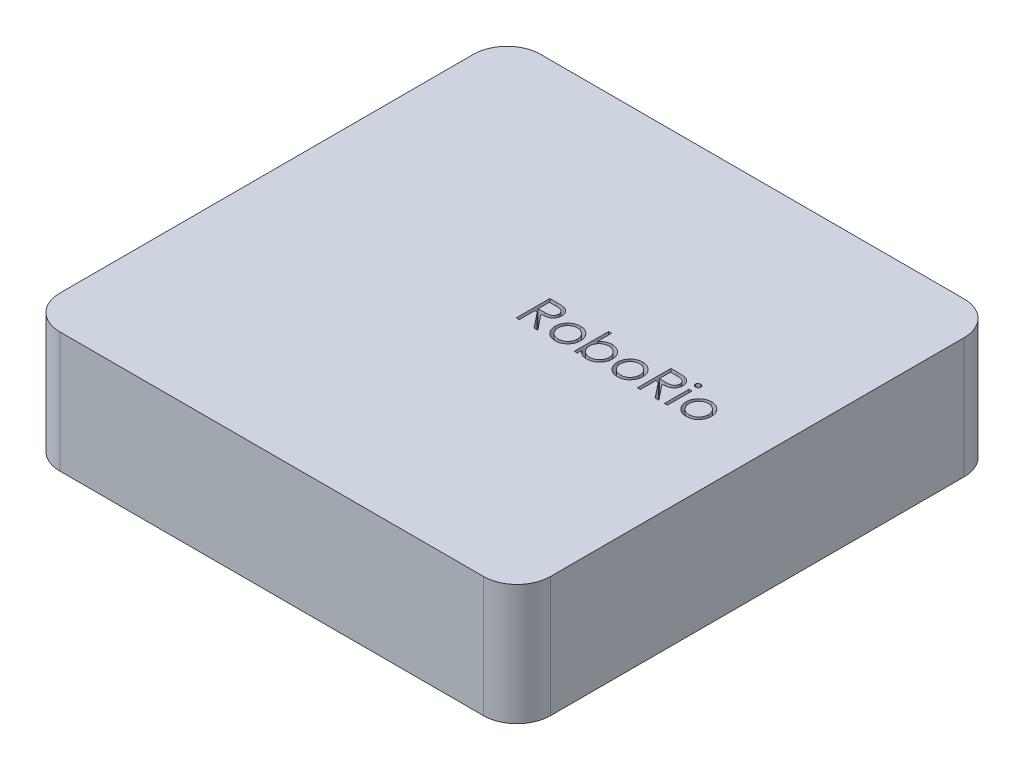
from build123d import *

# Parameters (mm, degrees)
SKETCH1_W           = 146.5
SKETCH1_H           = 143.5
BOSS_EXTRUDE1_DEPTH = 36
FILLET1_R           = 10
SKETCH2_W           = 0.897435897
SKETCH2_H           = 7.307692308
CUT_EXTRUDE1_DEPTH  = 10


with BuildPart() as part:
    # Sketch1 → Boss-Extrude1 (new body)
    with BuildSketch(Plane(origin=(0, 0, 0), x_dir=(1, 0, 0), z_dir=(0, 1, 0))):
        Rectangle(SKETCH1_W, SKETCH1_H)
    extrude(amount=BOSS_EXTRUDE1_DEPTH)

    # Fillet1
    fillet1_edges = [part.edges().sort_by_distance(p)[0] for p in [
        (73.25, 18, 71.75),
        (73.25, 18, -71.75),
        (-73.25, 18, -71.75),
        (-73.25, 18, 71.75),
    ]]
    fillet(fillet1_edges, radius=FILLET1_R)

    # Sketch2 → Cut-Extrude1 (cut)
    # profile 1 of 8: a face of its own
    with BuildSketch(Plane(origin=(0, 36, 0), x_dir=(1, 0, 0), z_dir=(0, 1, 0))):
        with BuildLine():
            Line((1.282051282, 10), (3.283253205, 10))
            add(Edge.make_bspline(
                [(3.283253205, 10), (3.416799287, 9.999555469), (3.673222556, 9.998701919), (4.040574757, 9.993942596), (4.374366463, 9.98030158), (4.674423147, 9.96856277), (4.940739304, 9.947157224), (5.174131563, 9.926698232), (5.373524985, 9.899916344), (5.494227417, 9.875043707), (5.548878205, 9.863782051)],
                knots=[0, 0, 0, 0, 1.410062039, 2.707475311, 3.878576406, 4.937260626, 5.877586885, 6.699081471, 7.410979367, 8, 8, 8, 8], degree=3))
            add(Edge.make_bspline(
                [(5.548878205, 9.863782051), (5.622039988, 9.845705579), (5.766802815, 9.809938254), (5.975231576, 9.734339395), (6.17384393, 9.646854753), (6.361814856, 9.544101266), (6.538202831, 9.425316181), (6.704826576, 9.292550117), (6.862442186, 9.146529529), (7.004675415, 8.983572839), (7.138786991, 8.812611383), (7.251897353, 8.627743506), (7.349401581, 8.434424856), (7.427031629, 8.230689377), (7.489540125, 8.018512886), (7.533615094, 7.795973467), (7.560047059, 7.564084967), (7.562738075, 7.405919513), (7.564102564, 7.325721154)],
                knots=[0, 0, 0, 0, 1.027469482, 2.033020251, 3.019912614, 3.986113645, 4.951240523, 5.91722682, 6.890402269, 7.87763091, 8.8651537, 9.85103654, 10.82876324, 11.815024772, 12.821070561, 13.842952187, 14.906261191, 16, 16, 16, 16], degree=3))
            add(Edge.make_bspline(
                [(7.564102564, 7.325721154), (7.559905427, 7.192477998), (7.551715724, 6.93248609), (7.475358285, 6.555169286), (7.350282515, 6.203199815), (7.17793026, 5.87702085), (6.958446044, 5.582990434), (6.694660927, 5.324731991), (6.386427751, 5.108617955), (6.099486848, 4.958752798), (5.846017706, 4.862773059), (5.637351098, 4.795240606), (5.409731163, 4.743063562), (5.165338778, 4.696320328), (4.903156905, 4.661029773), (4.623813935, 4.63518236), (4.327110645, 4.619027935), (4.123284733, 4.616622207), (4.018429487, 4.615384615)],
                knots=[0, 0, 0, 0, 1.260483769, 2.459530307, 3.627416485, 4.787058657, 5.939039949, 7.08810263, 8.267026773, 9.491475466, 10.141966685, 10.831826277, 11.566392101, 12.351337768, 13.187381173, 14.07005841, 15.007169909, 16, 16, 16, 16], degree=3))
            Line((4.018429487, 4.615384615), (7.692307692, 0))
            Line((7.692307692, 0), (6.582532051, 0))
            Line((6.582532051, 0), (2.908653846, 4.615384615))
            Line((2.908653846, 4.615384615), (2.179487179, 4.615384615))
            Line((2.179487179, 4.615384615), (2.179487179, 0))
            Line((2.179487179, 0), (1.282051282, 0))
            Line((1.282051282, 0), (1.282051282, 10))
        make_face()
        with BuildLine():
            Line((2.179487179, 8.974358974), (2.179487179, 5.641025641))
            Line((2.179487179, 5.641025641), (4.010416667, 5.627003205))
            add(Edge.make_bspline(
                [(4.010416667, 5.627003205), (4.095902492, 5.626965386), (4.26159837, 5.626892082), (4.501314555, 5.638302871), (4.724514874, 5.651283781), (4.930345594, 5.671139054), (5.118898667, 5.69672783), (5.290079847, 5.728736356), (5.444168567, 5.766027964), (5.623878677, 5.823746895), (5.824554481, 5.915192661), (6.042644366, 6.048236943), (6.228365331, 6.215577284), (6.385273509, 6.406930015), (6.511357599, 6.617319298), (6.600249183, 6.84422321), (6.656656161, 7.08191349), (6.663309148, 7.245279512), (6.666666667, 7.327724359)],
                knots=[0, 0, 0, 0, 1.146690395, 2.22261258, 3.21895312, 4.145990853, 4.996080663, 5.770904154, 6.481378293, 7.121626537, 8.300444488, 9.431385265, 10.535395872, 11.636531494, 12.74115979, 13.810798291, 14.895190096, 16, 16, 16, 16], degree=3))
            add(Edge.make_bspline(
                [(6.666666667, 7.327724359), (6.663232035, 7.408143141), (6.656425848, 7.567503823), (6.600857938, 7.800806424), (6.506888277, 8.02099771), (6.380253312, 8.227181953), (6.225970012, 8.414341198), (6.045061976, 8.574475921), (5.842475704, 8.706617249), (5.653129423, 8.791058336), (5.483888816, 8.842829345), (5.33694693, 8.879261242), (5.170914136, 8.908531153), (4.984984254, 8.931982755), (4.779951024, 8.952139739), (4.554777735, 8.96571625), (4.310958363, 8.973755861), (4.141967131, 8.974153258), (4.054487179, 8.974358974)],
                knots=[0, 0, 0, 0, 1.101028733, 2.181837193, 3.264309656, 4.369019818, 5.486613113, 6.575447106, 7.666700264, 8.788928104, 9.402425223, 10.0903467, 10.862060571, 11.710948788, 12.657782767, 13.684531032, 14.801375019, 16, 16, 16, 16], degree=3))
            Line((4.054487179, 8.974358974), (2.179487179, 8.974358974))
        make_face(mode=Mode.SUBTRACT)
    # profile 2 of 8: a face of its own
    with BuildSketch(Plane(origin=(0, 36, 0), x_dir=(1, 0, 0), z_dir=(0, 1, 0))):
        with BuildLine():
            add(Edge.make_bspline(
                [(13.016826923, 7.435897436), (13.153944845, 7.432977747), (13.422799581, 7.42725295), (13.816536398, 7.366067334), (14.192379644, 7.272503436), (14.551768764, 7.143156116), (14.890101037, 6.969779114), (15.212304592, 6.762895425), (15.517496045, 6.517802301), (15.700418986, 6.32820782), (15.793269231, 6.231971154)],
                knots=[0, 0, 0, 0, 1.054011418, 2.066658804, 3.057071809, 4.030435133, 4.997543892, 5.974964718, 6.972108034, 8, 8, 8, 8], degree=3))
            add(Edge.make_bspline(
                [(15.793269231, 6.231971154), (15.873217671, 6.139931194), (16.031567329, 5.957632502), (16.23461224, 5.662045037), (16.409530983, 5.355930464), (16.549710871, 5.035223816), (16.660239511, 4.702724756), (16.738712928, 4.357290438), (16.785389885, 3.999683732), (16.791684077, 3.756815623), (16.794871795, 3.633814103)],
                knots=[0, 0, 0, 0, 1.025258237, 2.030674902, 3.01204498, 3.988269485, 4.97094183, 5.956517959, 6.965070386, 8, 8, 8, 8], degree=3))
            add(Edge.make_bspline(
                [(16.794871795, 3.633814103), (16.792067974, 3.510099652), (16.786527493, 3.265634128), (16.734117161, 2.905578797), (16.652599772, 2.556450733), (16.535937378, 2.219711608), (16.38634278, 1.894332101), (16.203797958, 1.581733388), (15.987021909, 1.281298722), (15.741296204, 0.995579184), (15.469719415, 0.732247142), (15.175101848, 0.5027378), (14.863233181, 0.306104874), (14.529966457, 0.147715115), (14.178345066, 0.022830257), (13.807610586, -0.064884076), (13.418338956, -0.117917458), (13.152546895, -0.124727668), (13.016826923, -0.128205128)],
                knots=[0, 0, 0, 0, 0.998656419, 1.973391657, 2.932242238, 3.890759089, 4.846373663, 5.82037756, 6.809684879, 7.83454468, 8.860553229, 9.859544525, 10.845671541, 11.83227036, 12.833544569, 13.85385346, 14.904124723, 16, 16, 16, 16], degree=3))
            add(Edge.make_bspline(
                [(13.016826923, -0.128205128), (12.88044201, -0.124715996), (12.613325268, -0.117882355), (12.222679605, -0.065090118), (11.851280694, 0.022789832), (11.499198984, 0.148125525), (11.164499421, 0.306109936), (10.850823716, 0.502143335), (10.555966814, 0.732315207), (10.284332573, 0.995560741), (10.038622272, 1.281303474), (9.821842248, 1.581732155), (9.639298459, 1.894332422), (9.489703591, 2.219711522), (9.373041269, 2.556450756), (9.291523861, 2.905578791), (9.239113534, 3.26563413), (9.233573052, 3.510099653), (9.230769231, 3.633814103)],
                knots=[0, 0, 0, 0, 1.099876186, 2.154163076, 3.173186993, 4.173200201, 5.163417411, 6.152872554, 7.150605724, 8.17532212, 9.198891216, 10.186952605, 11.159729845, 12.11414092, 13.071450619, 14.029093627, 15.002601286, 16, 16, 16, 16], degree=3))
            add(Edge.make_bspline(
                [(9.230769231, 3.633814103), (9.233978689, 3.756147091), (9.240332864, 3.998345383), (9.28696289, 4.355279842), (9.365130195, 4.700129525), (9.475791327, 5.031345171), (9.617263301, 5.350646417), (9.789724124, 5.657517363), (9.994840217, 5.951768221), (10.152560079, 6.133831307), (10.232371795, 6.225961538)],
                knots=[0, 0, 0, 0, 1.031353054, 2.041901799, 3.029428768, 4.008703097, 4.981709435, 5.96992636, 6.972712378, 8, 8, 8, 8], degree=3))
            add(Edge.make_bspline(
                [(10.232371795, 6.225961538), (10.325082055, 6.323032793), (10.507413095, 6.513940497), (10.814123745, 6.758319137), (11.135534663, 6.96950792), (11.47760588, 7.139439964), (11.83669976, 7.2732643), (12.214469024, 7.366308629), (12.609541926, 7.4270325), (12.879712272, 7.432913008), (13.016826923, 7.435897436)],
                knots=[0, 0, 0, 0, 1.027980169, 2.021703884, 2.998553061, 3.971491411, 4.943284454, 5.930300938, 6.949603206, 8, 8, 8, 8], degree=3))
        make_face()
        with BuildLine():
            add(Edge.make_bspline(
                [(13.012820513, 6.538461538), (12.915855909, 6.535705562), (12.724429827, 6.530264755), (12.442659585, 6.48888217), (12.171402002, 6.423317873), (11.910142448, 6.330163426), (11.659761955, 6.209880858), (11.420020805, 6.062142686), (11.190213834, 5.888905667), (10.97483651, 5.690440891), (10.777172761, 5.473643764), (10.604378543, 5.242648453), (10.457449667, 5.001201749), (10.335049213, 4.749052575), (10.243885818, 4.483645678), (10.177677183, 4.207986731), (10.136333639, 3.921514113), (10.130943986, 3.726768346), (10.128205128, 3.627804487)],
                knots=[0, 0, 0, 0, 1.021534396, 2.016698045, 2.994645724, 3.958388632, 4.93408049, 5.916473867, 6.921342795, 7.962252576, 8.998418191, 10.008913653, 10.997312074, 11.973003931, 12.956656626, 13.948281152, 14.957379055, 16, 16, 16, 16], degree=3))
            add(Edge.make_bspline(
                [(10.128205128, 3.627804487), (10.132796053, 3.499941552), (10.14190818, 3.246157537), (10.216008855, 2.872411472), (10.339969655, 2.51360618), (10.507361883, 2.171845077), (10.717093936, 1.855638569), (10.964199841, 1.573720042), (11.246027556, 1.330332009), (11.559217557, 1.128386736), (11.897372751, 0.967930291), (12.255247954, 0.854218932), (12.62850708, 0.780299811), (12.883594883, 0.772952741), (13.012820513, 0.769230769)],
                knots=[0, 0, 0, 0, 1.016792936, 2.018143844, 3.017858371, 4.030088057, 5.03801393, 6.028138512, 7.003788237, 7.991172063, 8.984598303, 9.972568034, 10.972917682, 12, 12, 12, 12], degree=3))
            add(Edge.make_bspline(
                [(13.012820513, 0.769230769), (13.14203871, 0.772974427), (13.397111841, 0.780364304), (13.769852346, 0.853846646), (14.126749409, 0.968428534), (14.464553373, 1.128206276), (14.777600812, 1.33109889), (15.061455444, 1.572345681), (15.306451476, 1.856385257), (15.515976061, 2.17226391), (15.686109612, 2.513076345), (15.809490188, 2.872477694), (15.883769005, 3.246140671), (15.892857087, 3.499935902), (15.897435897, 3.627804487)],
                knots=[0, 0, 0, 0, 1.02726834, 2.027799167, 3.010890988, 4.004497153, 4.992059811, 5.971914811, 6.958719428, 7.966827853, 8.981595046, 9.981490638, 10.983022906, 12, 12, 12, 12], degree=3))
            add(Edge.make_bspline(
                [(15.897435897, 3.627804487), (15.894697983, 3.726768938), (15.889310186, 3.921515868), (15.847953145, 4.207980021), (15.78179446, 4.483670297), (15.690446982, 4.748961735), (15.568578371, 5.001854605), (15.418816105, 5.241939539), (15.246727461, 5.474443957), (15.046678544, 5.689740073), (14.831526036, 5.888983035), (14.601625927, 6.062209862), (14.362240274, 6.209231563), (14.11258718, 6.33119225), (13.85129413, 6.422470366), (13.580416618, 6.489260741), (13.29984859, 6.530089875), (13.109108466, 6.535653136), (13.012820513, 6.538461538)],
                knots=[0, 0, 0, 0, 1.042956736, 2.052379634, 3.044323526, 4.02829302, 5.004299113, 5.996692471, 7.007513377, 8.048758398, 9.090003419, 10.095195979, 11.07790575, 12.047570684, 13.018257071, 13.989683339, 14.985167495, 16, 16, 16, 16], degree=3))
        make_face(mode=Mode.SUBTRACT)
    # profile 3 of 8: a face of its own
    with BuildSketch(Plane(origin=(0, 36, 0), x_dir=(1, 0, 0), z_dir=(0, 1, 0))):
        with BuildLine():
            Line((18.58974359, 0), (18.58974359, 10.256410256))
            Line((18.58974359, 10.256410256), (19.487179487, 10.256410256))
            Line((19.487179487, 10.256410256), (19.487179487, 5.981570513))
            add(Edge.make_bspline(
                [(19.487179487, 5.981570513), (19.588303541, 6.098021747), (19.78560074, 6.325222905), (20.116390601, 6.621930476), (20.463263657, 6.873508982), (20.828858673, 7.080897892), (21.213695625, 7.238822484), (21.615787364, 7.354315026), (22.036161766, 7.423991892), (22.322787977, 7.431894958), (22.467948718, 7.435897436)],
                knots=[0, 0, 0, 0, 1.077089805, 2.101446609, 3.097517232, 4.067117542, 5.031729543, 5.997785507, 6.985986182, 8, 8, 8, 8], degree=3))
            add(Edge.make_bspline(
                [(22.467948718, 7.435897436), (22.596994826, 7.432353927), (22.852140974, 7.425347805), (23.227232823, 7.37210639), (23.588127895, 7.285769813), (23.934629746, 7.166077872), (24.265121553, 7.007269366), (24.582433145, 6.817151344), (24.884938815, 6.590756117), (25.167952773, 6.331903801), (25.428792448, 6.050884879), (25.657113906, 5.750369692), (25.849970181, 5.434726577), (26.00948816, 5.105012113), (26.132834025, 4.759879681), (26.217811931, 4.399667685), (26.271793258, 4.024730489), (26.278593961, 3.76955105), (26.282051282, 3.639823718)],
                knots=[0, 0, 0, 0, 1.034377878, 2.045141349, 3.03070803, 4.00595497, 4.978199603, 5.965204761, 6.967410914, 8.002051993, 9.036360596, 10.037508045, 11.022711142, 11.997267194, 12.969246472, 13.954813154, 14.960274251, 16, 16, 16, 16], degree=3))
            add(Edge.make_bspline(
                [(26.282051282, 3.639823718), (26.278518595, 3.512109382), (26.271552692, 3.260276824), (26.218348955, 2.889686663), (26.130502484, 2.533004665), (26.004899103, 2.191152502), (25.846999278, 1.862524178), (25.649538491, 1.55086588), (25.421507064, 1.250754521), (25.157703782, 0.97182986), (24.872236488, 0.714020146), (24.566767223, 0.490003388), (24.248990304, 0.296525902), (23.91395284, 0.143224623), (23.566615579, 0.019221991), (23.203257331, -0.066828554), (22.825933822, -0.117037283), (22.569594141, -0.124453189), (22.439903846, -0.128205128)],
                knots=[0, 0, 0, 0, 1.024244038, 2.01964794, 2.996620209, 3.965911562, 4.936179293, 5.91563013, 6.920572822, 7.955171681, 8.990768464, 10.002129126, 10.989675881, 11.969873457, 12.952483066, 13.943799762, 14.959703725, 16, 16, 16, 16], degree=3))
            add(Edge.make_bspline(
                [(22.439903846, -0.128205128), (22.291432097, -0.124089105), (22.000304884, -0.1160183), (21.574440127, -0.049106931), (21.171349985, 0.064783384), (20.786442704, 0.217816972), (20.425220639, 0.425041698), (20.085390403, 0.682060984), (19.769095052, 0.993109945), (19.582761294, 1.230428488), (19.487179487, 1.352163462)],
                knots=[0, 0, 0, 0, 1.035807596, 2.031038093, 2.998900396, 3.954262848, 4.914341711, 5.895762244, 6.92060972, 8, 8, 8, 8], degree=3))
            Line((19.487179487, 1.352163462), (19.487179487, 0))
            Line((19.487179487, 0), (18.58974359, 0))
        make_face()
        with BuildLine():
            add(Edge.make_bspline(
                [(22.431891026, 0.769230769), (22.56307489, 0.77389828), (22.822010972, 0.783111205), (23.202136088, 0.855035842), (23.565890972, 0.974704739), (23.911442636, 1.138372477), (24.233383527, 1.344149719), (24.520962482, 1.593138778), (24.776618794, 1.87742882), (24.989909583, 2.198096515), (25.167984567, 2.539384998), (25.290308214, 2.898397288), (25.37236456, 3.265525257), (25.380513984, 3.514513955), (25.384615385, 3.639823718)],
                knots=[0, 0, 0, 0, 1.031910345, 2.036826888, 3.032245421, 4.038315463, 5.03827337, 6.029480047, 7.023177075, 8.037597977, 9.052889626, 10.043399556, 11.015292101, 12, 12, 12, 12], degree=3))
            add(Edge.make_bspline(
                [(25.384615385, 3.639823718), (25.379221831, 3.765010981), (25.368456255, 4.014885726), (25.293099734, 4.385313346), (25.161506048, 4.744135131), (24.986883125, 5.090357956), (24.770117452, 5.413237385), (24.515814699, 5.703209177), (24.224723825, 5.953380561), (23.902371198, 6.161923621), (23.558999224, 6.332093773), (23.197597414, 6.448793845), (22.825717063, 6.525188666), (22.573158513, 6.534014747), (22.445913462, 6.538461538)],
                knots=[0, 0, 0, 0, 0.984795267, 1.965658976, 2.959410029, 3.983795688, 5.009594896, 6.01088574, 7.009236619, 8.019050059, 9.024672985, 10.014834719, 10.999826153, 12, 12, 12, 12], degree=3))
            add(Edge.make_bspline(
                [(22.445913462, 6.538461538), (22.316006297, 6.53401726), (22.058166936, 6.525196269), (21.677686301, 6.448659629), (21.306076919, 6.331380739), (20.950969685, 6.163005456), (20.619958098, 5.956972711), (20.323922063, 5.714857856), (20.068689041, 5.438343832), (19.858563982, 5.128327256), (19.691693128, 4.793512869), (19.572310991, 4.436335145), (19.500883429, 4.058674252), (19.49180305, 3.799722236), (19.487179487, 3.66786859)],
                knots=[0, 0, 0, 0, 1.016820015, 2.018181405, 3.029022337, 4.06341356, 5.088169224, 6.076823655, 7.05054209, 8.02560866, 9.001194327, 9.972267242, 10.967515442, 12, 12, 12, 12], degree=3))
            add(Edge.make_bspline(
                [(19.487179487, 3.66786859), (19.489921403, 3.566903394), (19.49531836, 3.368171939), (19.536547985, 3.076378537), (19.60213559, 2.79714113), (19.694545573, 2.530155429), (19.815977672, 2.27693703), (19.962292717, 2.035519658), (20.136440278, 1.80808172), (20.333316248, 1.595180805), (20.550351621, 1.401439621), (20.783274817, 1.233501835), (21.027326048, 1.088889863), (21.285297394, 0.973618885), (21.554186795, 0.879543111), (21.836753484, 0.817446695), (22.13010041, 0.77466087), (22.330234974, 0.77105986), (22.431891026, 0.769230769)],
                knots=[0, 0, 0, 0, 1.050331198, 2.067384183, 3.060053655, 4.031335885, 5.001026174, 5.976994447, 6.963687968, 7.976578778, 8.990422448, 9.985569286, 10.960374351, 11.936812464, 12.921228065, 13.919088064, 14.943024695, 16, 16, 16, 16], degree=3))
        make_face(mode=Mode.SUBTRACT)
    # profile 4 of 8: a face of its own
    with BuildSketch(Plane(origin=(0, 36, 0), x_dir=(1, 0, 0), z_dir=(0, 1, 0))):
        with BuildLine():
            add(Edge.make_bspline(
                [(31.606570513, 7.435897436), (31.743688435, 7.432977747), (32.012543171, 7.42725295), (32.406279988, 7.366067334), (32.782123233, 7.272503436), (33.141512354, 7.143156116), (33.479844627, 6.969779114), (33.802048181, 6.762895425), (34.107239635, 6.517802301), (34.290162576, 6.32820782), (34.383012821, 6.231971154)],
                knots=[0, 0, 0, 0, 1.054011418, 2.066658804, 3.057071809, 4.030435133, 4.997543892, 5.974964718, 6.972108034, 8, 8, 8, 8], degree=3))
            add(Edge.make_bspline(
                [(34.383012821, 6.231971154), (34.462961261, 6.139931194), (34.621310919, 5.957632502), (34.824355829, 5.662045037), (34.999274573, 5.355930464), (35.139454461, 5.035223816), (35.2499831, 4.702724756), (35.328456518, 4.357290438), (35.375133475, 3.999683732), (35.381427666, 3.756815623), (35.384615385, 3.633814103)],
                knots=[0, 0, 0, 0, 1.025258237, 2.030674902, 3.01204498, 3.988269485, 4.97094183, 5.956517959, 6.965070386, 8, 8, 8, 8], degree=3))
            add(Edge.make_bspline(
                [(35.384615385, 3.633814103), (35.381811564, 3.510099652), (35.376271083, 3.265634128), (35.32386075, 2.905578797), (35.242343362, 2.556450733), (35.125680967, 2.219711608), (34.976086369, 1.894332101), (34.793541548, 1.581733388), (34.576765499, 1.281298722), (34.331039794, 0.995579184), (34.059463005, 0.732247142), (33.764845438, 0.5027378), (33.45297677, 0.306104874), (33.119710047, 0.147715115), (32.768088656, 0.022830257), (32.397354175, -0.064884076), (32.008082546, -0.117917458), (31.742290485, -0.124727668), (31.606570513, -0.128205128)],
                knots=[0, 0, 0, 0, 0.998656419, 1.973391657, 2.932242238, 3.890759089, 4.846373663, 5.82037756, 6.809684879, 7.83454468, 8.860553229, 9.859544525, 10.845671541, 11.83227036, 12.833544569, 13.85385346, 14.904124723, 16, 16, 16, 16], degree=3))
            add(Edge.make_bspline(
                [(31.606570513, -0.128205128), (31.4701856, -0.124715996), (31.203068858, -0.117882355), (30.812423195, -0.065090118), (30.441024284, 0.022789832), (30.088942574, 0.148125525), (29.754243011, 0.306109936), (29.440567306, 0.502143335), (29.145710404, 0.732315207), (28.874076163, 0.995560741), (28.628365862, 1.281303474), (28.411585838, 1.581732155), (28.229042049, 1.894332422), (28.079447181, 2.219711522), (27.962784858, 2.556450756), (27.881267451, 2.905578791), (27.828857123, 3.26563413), (27.823316642, 3.510099653), (27.820512821, 3.633814103)],
                knots=[0, 0, 0, 0, 1.099876186, 2.154163076, 3.173186993, 4.173200201, 5.163417411, 6.152872554, 7.150605724, 8.17532212, 9.198891216, 10.186952605, 11.159729845, 12.11414092, 13.071450619, 14.029093627, 15.002601286, 16, 16, 16, 16], degree=3))
            add(Edge.make_bspline(
                [(27.820512821, 3.633814103), (27.823722279, 3.756147091), (27.830076454, 3.998345383), (27.87670648, 4.355279842), (27.954873784, 4.700129525), (28.065534917, 5.031345171), (28.207006891, 5.350646417), (28.379467714, 5.657517363), (28.584583807, 5.951768221), (28.742303668, 6.133831307), (28.822115385, 6.225961538)],
                knots=[0, 0, 0, 0, 1.031353054, 2.041901799, 3.029428768, 4.008703097, 4.981709435, 5.96992636, 6.972712378, 8, 8, 8, 8], degree=3))
            add(Edge.make_bspline(
                [(28.822115385, 6.225961538), (28.914825645, 6.323032793), (29.097156684, 6.513940497), (29.403867335, 6.758319137), (29.725278252, 6.96950792), (30.06734947, 7.139439964), (30.42644335, 7.2732643), (30.804212614, 7.366308629), (31.199285515, 7.4270325), (31.469455861, 7.432913008), (31.606570513, 7.435897436)],
                knots=[0, 0, 0, 0, 1.027980169, 2.021703884, 2.998553061, 3.971491411, 4.943284454, 5.930300938, 6.949603206, 8, 8, 8, 8], degree=3))
        make_face()
        with BuildLine():
            add(Edge.make_bspline(
                [(31.602564103, 6.538461538), (31.505599499, 6.535705562), (31.314173417, 6.530264755), (31.032403175, 6.48888217), (30.761145592, 6.423317873), (30.499886038, 6.330163426), (30.249505545, 6.209880858), (30.009764395, 6.062142686), (29.779957424, 5.888905667), (29.5645801, 5.690440891), (29.366916351, 5.473643764), (29.194122132, 5.242648453), (29.047193257, 5.001201749), (28.924792803, 4.749052575), (28.833629408, 4.483645678), (28.767420773, 4.207986731), (28.726077228, 3.921514113), (28.720687575, 3.726768346), (28.717948718, 3.627804487)],
                knots=[0, 0, 0, 0, 1.021534396, 2.016698045, 2.994645724, 3.958388632, 4.93408049, 5.916473867, 6.921342795, 7.962252576, 8.998418191, 10.008913653, 10.997312074, 11.973003931, 12.956656626, 13.948281152, 14.957379055, 16, 16, 16, 16], degree=3))
            add(Edge.make_bspline(
                [(28.717948718, 3.627804487), (28.722539643, 3.499941552), (28.73165177, 3.246157537), (28.805752445, 2.872411472), (28.929713245, 2.51360618), (29.097105473, 2.171845077), (29.306837526, 1.855638569), (29.553943431, 1.573720042), (29.835771146, 1.330332009), (30.148961147, 1.128386736), (30.487116341, 0.967930291), (30.844991544, 0.854218932), (31.21825067, 0.780299811), (31.473338473, 0.772952741), (31.602564103, 0.769230769)],
                knots=[0, 0, 0, 0, 1.016792936, 2.018143844, 3.017858371, 4.030088057, 5.03801393, 6.028138512, 7.003788237, 7.991172063, 8.984598303, 9.972568034, 10.972917682, 12, 12, 12, 12], degree=3))
            add(Edge.make_bspline(
                [(31.602564103, 0.769230769), (31.7317823, 0.772974427), (31.986855431, 0.780364304), (32.359595936, 0.853846646), (32.716492999, 0.968428534), (33.054296963, 1.128206276), (33.367344401, 1.33109889), (33.651199034, 1.572345681), (33.896195065, 1.856385257), (34.105719651, 2.17226391), (34.275853202, 2.513076345), (34.399233778, 2.872477694), (34.473512595, 3.246140671), (34.482600677, 3.499935902), (34.487179487, 3.627804487)],
                knots=[0, 0, 0, 0, 1.02726834, 2.027799167, 3.010890988, 4.004497153, 4.992059811, 5.971914811, 6.958719428, 7.966827853, 8.981595046, 9.981490638, 10.983022906, 12, 12, 12, 12], degree=3))
            add(Edge.make_bspline(
                [(34.487179487, 3.627804487), (34.484441573, 3.726768938), (34.479053775, 3.921515868), (34.437696734, 4.207980021), (34.37153805, 4.483670297), (34.280190572, 4.748961735), (34.158321961, 5.001854605), (34.008559695, 5.241939539), (33.836471051, 5.474443957), (33.636422134, 5.689740073), (33.421269626, 5.888983035), (33.191369517, 6.062209862), (32.951983863, 6.209231563), (32.70233077, 6.33119225), (32.44103772, 6.422470366), (32.170160208, 6.489260741), (31.889592179, 6.530089875), (31.698852056, 6.535653136), (31.602564103, 6.538461538)],
                knots=[0, 0, 0, 0, 1.042956736, 2.052379634, 3.044323526, 4.02829302, 5.004299113, 5.996692471, 7.007513377, 8.048758398, 9.090003419, 10.095195979, 11.07790575, 12.047570684, 13.018257071, 13.989683339, 14.985167495, 16, 16, 16, 16], degree=3))
        make_face(mode=Mode.SUBTRACT)
    # profile 5 of 8: a face of its own
    with BuildSketch(Plane(origin=(0, 36, 0), x_dir=(1, 0, 0), z_dir=(0, 1, 0))):
        with BuildLine():
            Line((37.435897436, 10), (39.437099359, 10))
            add(Edge.make_bspline(
                [(39.437099359, 10), (39.57064544, 9.999555469), (39.82706871, 9.998701919), (40.194420911, 9.993942596), (40.528212617, 9.98030158), (40.828269301, 9.96856277), (41.094585458, 9.947157224), (41.327977717, 9.926698232), (41.527371138, 9.899916344), (41.648073571, 9.875043707), (41.702724359, 9.863782051)],
                knots=[0, 0, 0, 0, 1.410062039, 2.707475311, 3.878576406, 4.937260626, 5.877586885, 6.699081471, 7.410979367, 8, 8, 8, 8], degree=3))
            add(Edge.make_bspline(
                [(41.702724359, 9.863782051), (41.775886142, 9.845705579), (41.920648969, 9.809938254), (42.129077729, 9.734339395), (42.327690084, 9.646854753), (42.51566101, 9.544101266), (42.692048985, 9.425316181), (42.85867273, 9.292550117), (43.01628834, 9.146529529), (43.158521569, 8.983572839), (43.292633145, 8.812611383), (43.405743507, 8.627743506), (43.503247734, 8.434424856), (43.580877783, 8.230689377), (43.643386279, 8.018512886), (43.687461248, 7.795973467), (43.713893213, 7.564084967), (43.716584229, 7.405919513), (43.717948718, 7.325721154)],
                knots=[0, 0, 0, 0, 1.027469482, 2.033020251, 3.019912614, 3.986113645, 4.951240523, 5.91722682, 6.890402269, 7.87763091, 8.8651537, 9.85103654, 10.82876324, 11.815024772, 12.821070561, 13.842952187, 14.906261191, 16, 16, 16, 16], degree=3))
            add(Edge.make_bspline(
                [(43.717948718, 7.325721154), (43.71375158, 7.192477998), (43.705561878, 6.93248609), (43.629204439, 6.555169286), (43.504128669, 6.203199815), (43.331776414, 5.87702085), (43.112292198, 5.582990434), (42.84850708, 5.324731991), (42.540273905, 5.108617955), (42.253333002, 4.958752798), (41.99986386, 4.862773059), (41.791197252, 4.795240606), (41.563577316, 4.743063562), (41.319184932, 4.696320328), (41.057003059, 4.661029773), (40.777660089, 4.63518236), (40.480956799, 4.619027935), (40.277130886, 4.616622207), (40.172275641, 4.615384615)],
                knots=[0, 0, 0, 0, 1.260483769, 2.459530307, 3.627416485, 4.787058657, 5.939039949, 7.08810263, 8.267026773, 9.491475466, 10.141966685, 10.831826277, 11.566392101, 12.351337768, 13.187381173, 14.07005841, 15.007169909, 16, 16, 16, 16], degree=3))
            Line((40.172275641, 4.615384615), (43.846153846, 0))
            Line((43.846153846, 0), (42.736378205, 0))
            Line((42.736378205, 0), (39.0625, 4.615384615))
            Line((39.0625, 4.615384615), (38.333333333, 4.615384615))
            Line((38.333333333, 4.615384615), (38.333333333, 0))
            Line((38.333333333, 0), (37.435897436, 0))
            Line((37.435897436, 0), (37.435897436, 10))
        make_face()
        with BuildLine():
            Line((38.333333333, 8.974358974), (38.333333333, 5.641025641))
            Line((38.333333333, 5.641025641), (40.164262821, 5.627003205))
            add(Edge.make_bspline(
                [(40.164262821, 5.627003205), (40.249748646, 5.626965386), (40.415444523, 5.626892082), (40.655160709, 5.638302871), (40.878361028, 5.651283781), (41.084191748, 5.671139054), (41.272744821, 5.69672783), (41.443926001, 5.728736356), (41.598014721, 5.766027964), (41.777724831, 5.823746895), (41.978400635, 5.915192661), (42.19649052, 6.048236943), (42.382211485, 6.215577284), (42.539119663, 6.406930015), (42.665203753, 6.617319298), (42.754095337, 6.84422321), (42.810502315, 7.08191349), (42.817155302, 7.245279512), (42.820512821, 7.327724359)],
                knots=[0, 0, 0, 0, 1.146690395, 2.22261258, 3.21895312, 4.145990853, 4.996080663, 5.770904154, 6.481378293, 7.121626537, 8.300444488, 9.431385265, 10.535395872, 11.636531494, 12.74115979, 13.810798291, 14.895190096, 16, 16, 16, 16], degree=3))
            add(Edge.make_bspline(
                [(42.820512821, 7.327724359), (42.817078189, 7.408143141), (42.810272002, 7.567503823), (42.754704092, 7.800806424), (42.660734431, 8.02099771), (42.534099466, 8.227181953), (42.379816166, 8.414341198), (42.198908129, 8.574475921), (41.996321857, 8.706617249), (41.806975576, 8.791058336), (41.637734969, 8.842829345), (41.490793084, 8.879261242), (41.32476029, 8.908531153), (41.138830408, 8.931982755), (40.933797177, 8.952139739), (40.708623889, 8.96571625), (40.464804516, 8.973755861), (40.295813285, 8.974153258), (40.208333333, 8.974358974)],
                knots=[0, 0, 0, 0, 1.101028733, 2.181837193, 3.264309656, 4.369019818, 5.486613113, 6.575447106, 7.666700264, 8.788928104, 9.402425223, 10.0903467, 10.862060571, 11.710948788, 12.657782767, 13.684531032, 14.801375019, 16, 16, 16, 16], degree=3))
            Line((40.208333333, 8.974358974), (38.333333333, 8.974358974))
        make_face(mode=Mode.SUBTRACT)
    # profile 6 of 8: a face of its own
    with BuildSketch(Plane(origin=(0, 36, 0), x_dir=(1, 0, 0), z_dir=(0, 1, 0))):
        with BuildLine():
            add(Edge.make_bspline(
                [(45.957532051, 10.384615385), (46.013221525, 10.382032092), (46.12227221, 10.376973509), (46.279967261, 10.333655003), (46.423558724, 10.26022733), (46.550923675, 10.161713956), (46.66021478, 10.045858404), (46.736731095, 9.910827066), (46.78590937, 9.764945241), (46.791848099, 9.663187843), (46.794871795, 9.611378205)],
                knots=[0, 0, 0, 0, 1.055194115, 2.066272739, 3.074728998, 4.095836921, 5.109056067, 6.073838105, 7.019297344, 8, 8, 8, 8], degree=3))
            add(Edge.make_bspline(
                [(46.794871795, 9.611378205), (46.79177991, 9.560913482), (46.785667618, 9.461150696), (46.736769081, 9.317797919), (46.659562687, 9.184642823), (46.550993756, 9.069012222), (46.423540154, 8.970553308), (46.279972194, 8.897111197), (46.122270913, 8.853796519), (46.013221086, 8.848737408), (45.957532051, 8.846153846)],
                knots=[0, 0, 0, 0, 0.96129708, 1.900370562, 2.859976407, 3.87933698, 4.906634145, 5.921202961, 6.938410037, 8, 8, 8, 8], degree=3))
            add(Edge.make_bspline(
                [(45.957532051, 8.846153846), (45.902479837, 8.848638761), (45.795327893, 8.853475323), (45.639994058, 8.897961088), (45.497626945, 8.97057844), (45.370013595, 9.06836754), (45.263641615, 9.185352961), (45.186217828, 9.317716658), (45.137432222, 9.461171385), (45.131304712, 9.560920432), (45.128205128, 9.611378205)],
                knots=[0, 0, 0, 0, 1.054934014, 2.053291228, 3.073705704, 4.106921865, 5.123545215, 6.088680038, 7.033164197, 8, 8, 8, 8], degree=3))
            add(Edge.make_bspline(
                [(45.128205128, 9.611378205), (45.131236804, 9.663180633), (45.137191207, 9.764923869), (45.186254396, 9.910909677), (45.262996704, 10.045142539), (45.370084029, 10.162358252), (45.497608201, 10.260202351), (45.639998901, 10.332805156), (45.795326614, 10.377294697), (45.902479402, 10.382130738), (45.957532051, 10.384615385)],
                knots=[0, 0, 0, 0, 0.98631895, 1.937192651, 2.907499808, 3.917963147, 4.944918757, 5.95915025, 6.951458133, 8, 8, 8, 8], degree=3))
        make_face()
    # profile 7 of 8: a face of its own
    with BuildSketch(Plane(origin=(0, 36, 0), x_dir=(1, 0, 0), z_dir=(0, 1, 0))):
        with Locations((45.961538461, 3.653846154)):
            Rectangle(SKETCH2_W, SKETCH2_H)
    # profile 8 of 8: a face of its own
    with BuildSketch(Plane(origin=(0, 36, 0), x_dir=(1, 0, 0), z_dir=(0, 1, 0))):
        with BuildLine():
            add(Edge.make_bspline(
                [(52.119391026, 7.435897436), (52.256508948, 7.432977747), (52.525363684, 7.42725295), (52.919100501, 7.366067334), (53.294943746, 7.272503436), (53.654332867, 7.143156116), (53.992665139, 6.969779114), (54.314868694, 6.762895425), (54.620060148, 6.517802301), (54.802983089, 6.32820782), (54.895833333, 6.231971154)],
                knots=[0, 0, 0, 0, 1.054011418, 2.066658804, 3.057071809, 4.030435133, 4.997543892, 5.974964718, 6.972108034, 8, 8, 8, 8], degree=3))
            add(Edge.make_bspline(
                [(54.895833333, 6.231971154), (54.975781774, 6.139931194), (55.134131431, 5.957632502), (55.337176342, 5.662045037), (55.512095085, 5.355930464), (55.652274974, 5.035223816), (55.762803613, 4.702724756), (55.841277031, 4.357290438), (55.887953988, 3.999683732), (55.894248179, 3.756815623), (55.897435897, 3.633814103)],
                knots=[0, 0, 0, 0, 1.025258237, 2.030674902, 3.01204498, 3.988269485, 4.97094183, 5.956517959, 6.965070386, 8, 8, 8, 8], degree=3))
            add(Edge.make_bspline(
                [(55.897435897, 3.633814103), (55.894632077, 3.510099652), (55.889091596, 3.265634128), (55.836681263, 2.905578797), (55.755163875, 2.556450733), (55.63850148, 2.219711608), (55.488906882, 1.894332101), (55.306362061, 1.581733388), (55.089586012, 1.281298722), (54.843860307, 0.995579184), (54.572283518, 0.732247142), (54.277665951, 0.5027378), (53.965797283, 0.306104874), (53.63253056, 0.147715115), (53.280909169, 0.022830257), (52.910174688, -0.064884076), (52.520903059, -0.117917458), (52.255110998, -0.124727668), (52.119391026, -0.128205128)],
                knots=[0, 0, 0, 0, 0.998656419, 1.973391657, 2.932242238, 3.890759089, 4.846373663, 5.82037756, 6.809684879, 7.83454468, 8.860553229, 9.859544525, 10.845671541, 11.83227036, 12.833544569, 13.85385346, 14.904124723, 16, 16, 16, 16], degree=3))
            add(Edge.make_bspline(
                [(52.119391026, -0.128205128), (51.983006113, -0.124715996), (51.715889371, -0.117882355), (51.325243708, -0.065090118), (50.953844797, 0.022789832), (50.601763087, 0.148125525), (50.267063524, 0.306109936), (49.953387818, 0.502143335), (49.658530917, 0.732315207), (49.386896676, 0.995560741), (49.141186375, 1.281303474), (48.924406351, 1.581732155), (48.741862562, 1.894332422), (48.592267694, 2.219711522), (48.475605371, 2.556450756), (48.394087964, 2.905578791), (48.341677636, 3.26563413), (48.336137155, 3.510099653), (48.333333333, 3.633814103)],
                knots=[0, 0, 0, 0, 1.099876186, 2.154163076, 3.173186993, 4.173200201, 5.163417411, 6.152872554, 7.150605724, 8.17532212, 9.198891216, 10.186952605, 11.159729845, 12.11414092, 13.071450619, 14.029093627, 15.002601286, 16, 16, 16, 16], degree=3))
            add(Edge.make_bspline(
                [(48.333333333, 3.633814103), (48.336542791, 3.756147091), (48.342896967, 3.998345383), (48.389526993, 4.355279842), (48.467694297, 4.700129525), (48.57835543, 5.031345171), (48.719827404, 5.350646417), (48.892288227, 5.657517363), (49.09740432, 5.951768221), (49.255124181, 6.133831307), (49.334935897, 6.225961538)],
                knots=[0, 0, 0, 0, 1.031353054, 2.041901799, 3.029428768, 4.008703097, 4.981709435, 5.96992636, 6.972712378, 8, 8, 8, 8], degree=3))
            add(Edge.make_bspline(
                [(49.334935897, 6.225961538), (49.427646158, 6.323032793), (49.609977197, 6.513940497), (49.916687848, 6.758319137), (50.238098765, 6.96950792), (50.580169983, 7.139439964), (50.939263863, 7.2732643), (51.317033127, 7.366308629), (51.712106028, 7.4270325), (51.982276374, 7.432913008), (52.119391026, 7.435897436)],
                knots=[0, 0, 0, 0, 1.027980169, 2.021703884, 2.998553061, 3.971491411, 4.943284454, 5.930300938, 6.949603206, 8, 8, 8, 8], degree=3))
        make_face()
        with BuildLine():
            add(Edge.make_bspline(
                [(52.115384615, 6.538461538), (52.018420012, 6.535705562), (51.82699393, 6.530264755), (51.545223688, 6.48888217), (51.273966105, 6.423317873), (51.01270655, 6.330163426), (50.762326058, 6.209880858), (50.522584908, 6.062142686), (50.292777937, 5.888905667), (50.077400613, 5.690440891), (49.879736864, 5.473643764), (49.706942645, 5.242648453), (49.56001377, 5.001201749), (49.437613316, 4.749052575), (49.346449921, 4.483645678), (49.280241285, 4.207986731), (49.238897741, 3.921514113), (49.233508088, 3.726768346), (49.230769231, 3.627804487)],
                knots=[0, 0, 0, 0, 1.021534396, 2.016698045, 2.994645724, 3.958388632, 4.93408049, 5.916473867, 6.921342795, 7.962252576, 8.998418191, 10.008913653, 10.997312074, 11.973003931, 12.956656626, 13.948281152, 14.957379055, 16, 16, 16, 16], degree=3))
            add(Edge.make_bspline(
                [(49.230769231, 3.627804487), (49.235360155, 3.499941552), (49.244472282, 3.246157537), (49.318572958, 2.872411472), (49.442533758, 2.51360618), (49.609925985, 2.171845077), (49.819658039, 1.855638569), (50.066763944, 1.573720042), (50.348591659, 1.330332009), (50.661781659, 1.128386736), (50.999936853, 0.967930291), (51.357812057, 0.854218932), (51.731071182, 0.780299811), (51.986158986, 0.772952741), (52.115384615, 0.769230769)],
                knots=[0, 0, 0, 0, 1.016792936, 2.018143844, 3.017858371, 4.030088057, 5.03801393, 6.028138512, 7.003788237, 7.991172063, 8.984598303, 9.972568034, 10.972917682, 12, 12, 12, 12], degree=3))
            add(Edge.make_bspline(
                [(52.115384615, 0.769230769), (52.244602812, 0.772974427), (52.499675944, 0.780364304), (52.872416449, 0.853846646), (53.229313511, 0.968428534), (53.567117476, 1.128206276), (53.880164914, 1.33109889), (54.164019546, 1.572345681), (54.409015578, 1.856385257), (54.618540164, 2.17226391), (54.788673714, 2.513076345), (54.912054291, 2.872477694), (54.986333108, 3.246140671), (54.99542119, 3.499935902), (55, 3.627804487)],
                knots=[0, 0, 0, 0, 1.02726834, 2.027799167, 3.010890988, 4.004497153, 4.992059811, 5.971914811, 6.958719428, 7.966827853, 8.981595046, 9.981490638, 10.983022906, 12, 12, 12, 12], degree=3))
            add(Edge.make_bspline(
                [(55, 3.627804487), (54.997262086, 3.726768938), (54.991874288, 3.921515868), (54.950517247, 4.207980021), (54.884358562, 4.483670297), (54.793011084, 4.748961735), (54.671142473, 5.001854605), (54.521380208, 5.241939539), (54.349291564, 5.474443957), (54.149242647, 5.689740073), (53.934090138, 5.888983035), (53.704190029, 6.062209862), (53.464804376, 6.209231563), (53.215151283, 6.33119225), (52.953858232, 6.422470366), (52.682980721, 6.489260741), (52.402412692, 6.530089875), (52.211672569, 6.535653136), (52.115384615, 6.538461538)],
                knots=[0, 0, 0, 0, 1.042956736, 2.052379634, 3.044323526, 4.02829302, 5.004299113, 5.996692471, 7.007513377, 8.048758398, 9.090003419, 10.095195979, 11.07790575, 12.047570684, 13.018257071, 13.989683339, 14.985167495, 16, 16, 16, 16], degree=3))
        make_face(mode=Mode.SUBTRACT)
    extrude(amount=-CUT_EXTRUDE1_DEPTH, mode=Mode.SUBTRACT)


solid = part.part
